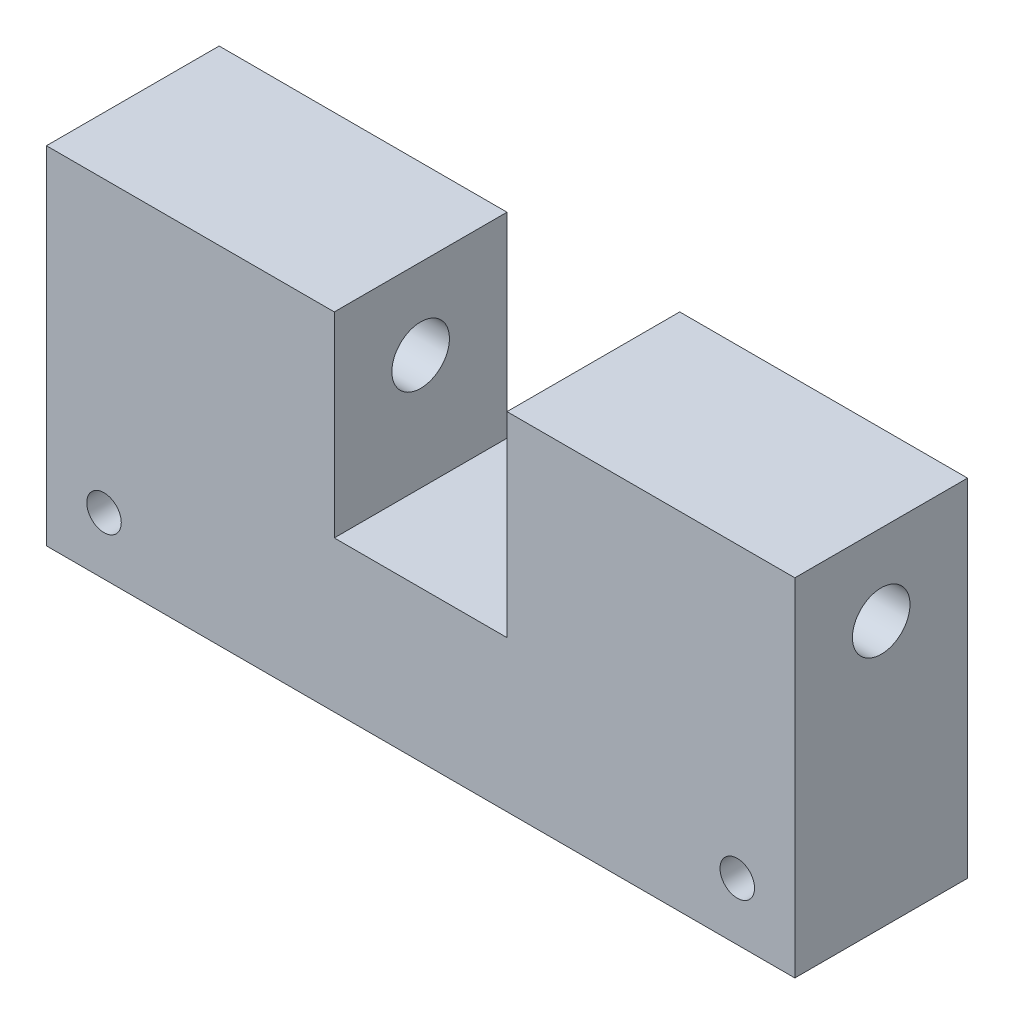
from build123d import *

# Parameters (mm, degrees)
SKETCH1_W           = 65
SKETCH1_H           = 30.1
SKETCH1_R           = 1.5
BOSS_EXTRUDE1_DEPTH = 15
SKETCH2_R           = 2.5
CUT_EXTRUDE1_DEPTH  = 75
SKETCH3_W           = 15
SKETCH3_H           = 17
CUT_EXTRUDE2_DEPTH  = 75


with BuildPart() as part:
    # Sketch1 → Boss-Extrude1 (new body)
    with BuildSketch(Plane.XY):
        with Locations((10, 0.55)):
            Rectangle(SKETCH1_W, SKETCH1_H)
        with Locations((-17.5, -9.5)):
            Circle(SKETCH1_R, mode=Mode.SUBTRACT)
        with Locations((37.5, -9.5)):
            Circle(SKETCH1_R, mode=Mode.SUBTRACT)
    extrude(amount=BOSS_EXTRUDE1_DEPTH)

    # Sketch2 → Cut-Extrude1 (cut)
    with BuildSketch(Plane.ZY.offset(22.5)):
        with Locations((7.5, 8.6)):
            Circle(SKETCH2_R)
    extrude(amount=-CUT_EXTRUDE1_DEPTH, mode=Mode.SUBTRACT)

    # Sketch3 → Cut-Extrude2 (cut)
    with BuildSketch(Plane.XY.offset(15)):
        with Locations((10, 7.1)):
            Rectangle(SKETCH3_W, SKETCH3_H)
    extrude(amount=-CUT_EXTRUDE2_DEPTH, mode=Mode.SUBTRACT)


solid = part.part
